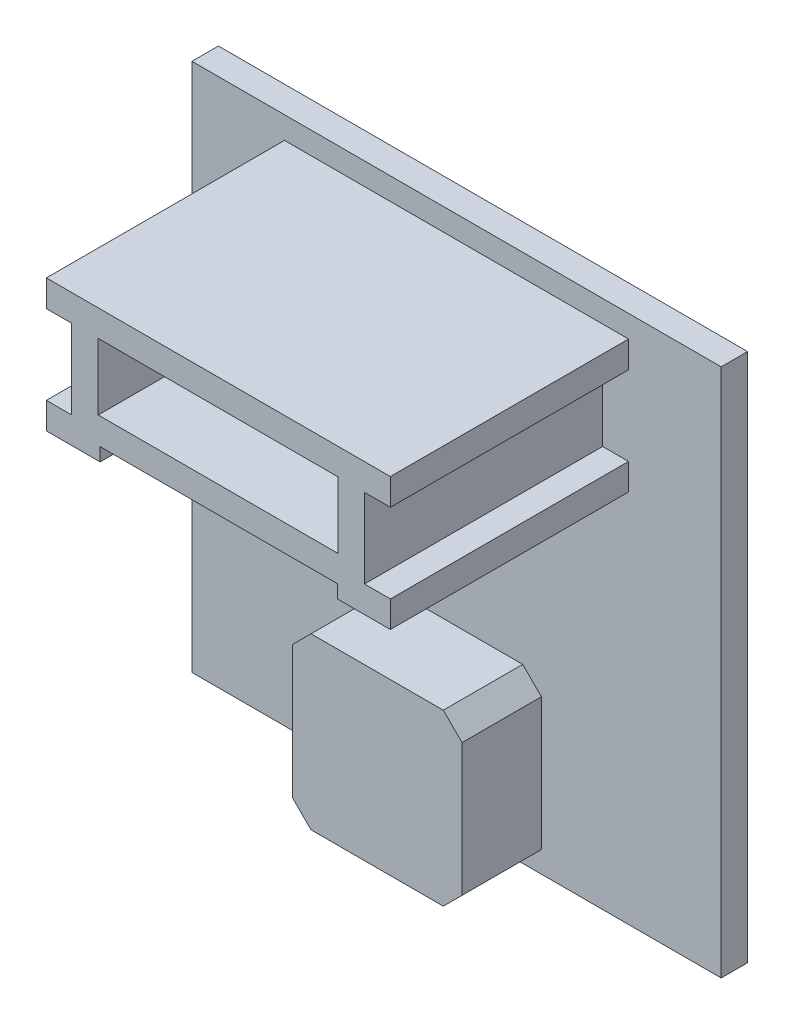
from build123d import *

# Parameters (mm, degrees)
ESQUISSE1_W        = 2
ESQUISSE1_H        = 2
BOSS_EXTRU_1_DEPTH = 0.1
BOSS_EXTRU_2_DEPTH = 0.9
COQUE3_START       = 0.1
COQUE3_OUTLINE_W   = 0.906146658
COQUE3_OUTLINE_H   = 0.250612044
COQUE3_DEPTH       = 0.9
BOSS_EXTRU_3_DEPTH = 0.3


# Read off the part's stored shape, not the designer's step: Coque3
with BuildPart() as part:
    # Esquisse1 → Boss.-Extru.1 (new body)
    with BuildSketch(Plane.XY):
        with Locations((1, 1)):
            Rectangle(ESQUISSE1_W, ESQUISSE1_H)
    extrude(amount=BOSS_EXTRU_1_DEPTH)

    # Esquisse2 → Boss.-Extru.2 (add)
    with BuildSketch(Plane.XY.offset(0.1)):
        Polygon((0.35, 1.916037567), (1.65, 1.916037567), (1.65, 1.815425523), (1.552079072, 1.815425523), (1.552079072, 1.515425523), (1.65, 1.515425523), (1.65, 1.415425523), (1.45, 1.415425523), (1.45, 1.465425523), (0.553370886, 1.465425523), (0.553370886, 1.415425523), (0.35, 1.415425523), (0.35, 1.515425523), (0.445932414, 1.515425523), (0.445932414, 1.815425523), (0.35, 1.815425523), align=None)
    extrude(amount=BOSS_EXTRU_2_DEPTH)

    # Coque3 outline → Coque3 (cut)
    with BuildSketch(Plane.XY.offset(COQUE3_START)):
        with Locations((0.999005743, 1.690731545)):
            Rectangle(COQUE3_OUTLINE_W, COQUE3_OUTLINE_H)
    extrude(amount=COQUE3_DEPTH, mode=Mode.SUBTRACT)

    # Esquisse3 → Boss.-Extru.3 (add)
    with BuildSketch(Plane.XY.offset(0.1)):
        Polygon((0.679289322, 0.580710678), (0.679289322, 0.080710678), (0.75, 0.01), (1.25, 0.01), (1.320710678, 0.080710678), (1.320710678, 0.580710678), (1.25, 0.651421356), (0.75, 0.651421356), align=None)
    extrude(amount=BOSS_EXTRU_3_DEPTH)


solid = part.part
